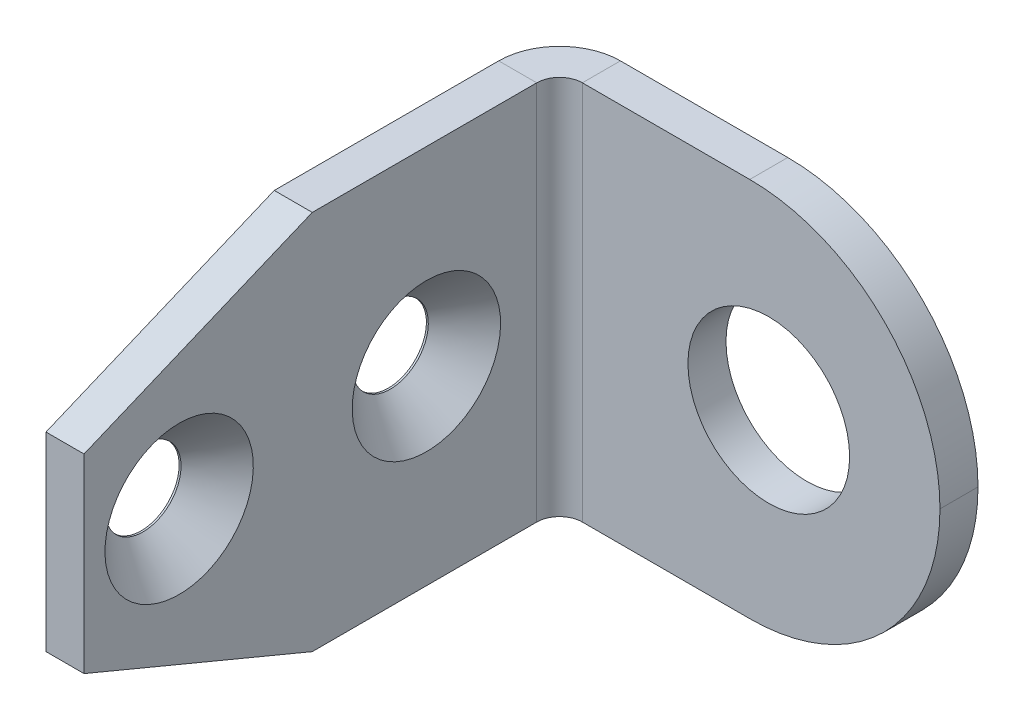
from build123d import *

# Parameters (mm, degrees)
SKETCH_1_W                       = 2
SKETCH_1_H                       = 20
SM_BASE_FLANGE_1_DEPTH           = 25
SM_EDGE_FLANGE_1_STRIP_W         = 10.4
SM_EDGE_FLANGE_1_STRIP_H         = 2
SM_EDGE_FLANGE_1_STRIP_CUT_DEPTH = 20
SM_EDGE_FLANGE_1_DEPTH           = 20
SKETCH_6_R                       = 4.25
CUT_EXTRUDE_1_DEPTH              = 10
FILLET_1_R                       = 10
SKETCH_7_R                       = 2
CUT_EXTRUDE_2_DEPTH              = 10
CUT_EXTRUDE_3_DEPTH              = 5
CHAMFER_1_SIZE                   = 1.9


# Sheet-metal steps are written as plain solids
with BuildPart() as part:
    # Sketch 1 → Базовая кромка1 (new body)
    with BuildSketch(Plane.XY):
        with Locations((-34.970714213, 7.011351052)):
            Rectangle(SKETCH_1_W, SKETCH_1_H)
    extrude(amount=SM_BASE_FLANGE_1_DEPTH)

    # Ребро-кромка1 strip (across the edge) → Ребро-кромка1 strip cut (cut)
    with BuildSketch(Plane(origin=(-33.970714213, -2.988648948, 0), x_dir=(0, 0, 1), z_dir=(0, 1, 0))):
        with Locations((-4, -1)):
            Rectangle(SM_EDGE_FLANGE_1_STRIP_W, SM_EDGE_FLANGE_1_STRIP_H)
    extrude(amount=SM_EDGE_FLANGE_1_STRIP_CUT_DEPTH, mode=Mode.SUBTRACT)

    # Ребро-кромка1 section (across the edge) → Ребро-кромка1 (add)
    with BuildSketch(Plane(origin=(-33.970714213, -2.988648948, 0), x_dir=(0, 0, 1), z_dir=(0, 1, 0))):
        with BuildLine():
            Line((-2, 1.2), (-2, 20))
            Line((-2, 20), (0, 20))
            Line((0, 20), (0, 1.2))
            ThreePointArc((0, 1.2), (0.351471863, 0.351471863), (1.2, 0))
            Line((1.2, 0), (1.2, -2))
            ThreePointArc((1.2, -2), (-1.0627417, -1.0627417), (-2, 1.2))
        make_face()
    extrude(amount=SM_EDGE_FLANGE_1_DEPTH)

    # Эскиз6 → Вырез-Вытянуть1 (cut)
    with BuildSketch(Plane.XY):
        with Locations((-22.970714213, 7.011351052)):
            Circle(SKETCH_6_R)
    extrude(amount=-CUT_EXTRUDE_1_DEPTH, mode=Mode.SUBTRACT)

    # Скругление1
    fillet_1_edges = [part.edges().sort_by_distance(p)[0] for p in [
        (-13.970714213, 17.011351052, -1),
        (-13.970714213, -2.988648948, -1),
    ]]
    fillet(fillet_1_edges, radius=FILLET_1_R - 0.0001)  # a hair under: the kernel refuses the full size

    # Эскиз7 → Вырез-Вытянуть2 (cut)
    with BuildSketch(Plane(origin=(-33.970714213, 0, 0), x_dir=(0, 0, -1), z_dir=(1, 0, 0))):
        with Locations(Location((-20, 7.011351052, 0), (0, 0, 90))):
            Circle(SKETCH_7_R)
        with Locations(Location((-7, 7.011351052, 0), (0, 0, 90))):
            Circle(SKETCH_7_R)
    extrude(amount=-CUT_EXTRUDE_2_DEPTH, mode=Mode.SUBTRACT)

    # Эскиз9 → Вырез-Вытянуть3 (cut)
    with BuildSketch(Plane(origin=(-33.970714213, 0, 0), x_dir=(0, 0, -1), z_dir=(1, 0, 0))):
        Polygon((-25, 17.011351052), (-13, 17.011351052), (-25, 12.011351052), align=None)
        Polygon((-25, 2.011351052), (-13, -2.988648948), (-25, -2.988648948), align=None)
    extrude(amount=-CUT_EXTRUDE_3_DEPTH, mode=Mode.SUBTRACT)

    # Фаска1
    chamfer_1_edges = [part.edges().sort_by_distance(p)[0] for p in [
        (-33.970714213, 5.011351052, 20),
        (-33.970714213, 5.011351052, 7),
    ]]
    chamfer(chamfer_1_edges, length=CHAMFER_1_SIZE)


solid = part.part
